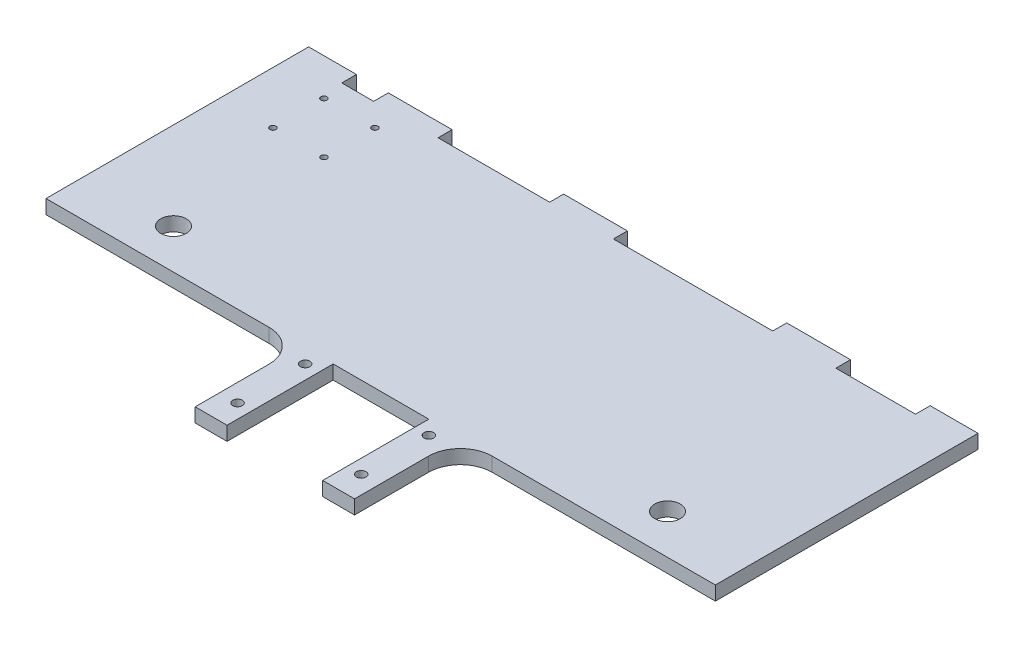
from build123d import *

# Parameters (mm, degrees)
BOSS_EXTRUDE1_DEPTH   = 5.588
F_6_CLEARANCE_HOLE1_D = 3.7973
M2_CLEARANCE_HOLE1_D  = 2.4
CUT_EXTRUDE1_REACH    = 300.407
SKETCH8_R             = 5.08


with BuildPart() as part:
    # Sketch1 → Boss-Extrude1 (new body)
    with BuildSketch(Plane(origin=(0, 0, 0), x_dir=(1, 0, 0), z_dir=(0, 1, 0))):
        with BuildLine():
            Line((12.7, 104.648), (31.75, 104.648))
            Line((31.75, 104.648), (31.75, 98.806))
            Line((31.75, 98.806), (44.45, 98.806))
            Line((44.45, 98.806), (44.45, 104.648))
            Line((44.45, 104.648), (69.85, 104.648))
            Line((69.85, 104.648), (69.85, 99.06))
            Line((69.85, 99.06), (114.3, 99.06))
            Line((114.3, 99.06), (114.3, 104.648))
            Line((114.3, 104.648), (139.7, 104.648))
            Line((139.7, 104.648), (139.7, 99.06))
            Line((139.7, 99.06), (203.2, 99.06))
            Line((203.2, 99.06), (203.2, 104.648))
            Line((203.2, 104.648), (228.6, 104.648))
            Line((228.6, 104.648), (228.6, 98.806))
            Line((228.6, 98.806), (260.35, 98.806))
            Line((260.35, 98.806), (260.35, 104.648))
            Line((260.35, 104.648), (279.4, 104.648))
            Line((279.4, 104.648), (279.4, 0))
            Line((279.4, 0), (190.5, 0))
            ThreePointArc((190.5, 0), (181.519743879, -3.719743879), (177.8, -12.7))
            Line((177.8, -12.7), (177.8, -42.164))
            Line((177.8, -42.164), (165.1, -42.164))
            Line((165.1, -42.164), (165.1, 0.122766638))
            Line((165.1, 0.122766638), (146.05, 0.122766638))
            Line((146.05, 0.122766638), (127, 0.122766638))
            Line((127, 0.122766638), (127, -42.164))
            Line((127, -42.164), (114.3, -42.164))
            Line((114.3, -42.164), (114.3, -12.7))
            ThreePointArc((114.3, -12.7), (110.580256121, -3.719743879), (101.6, 0))
            Line((101.6, 0), (12.7, 0))
            Line((12.7, 0), (12.7, 104.648))
        make_face()
    extrude(amount=BOSS_EXTRUDE1_DEPTH)

    # #6 Clearance Hole1 (through all)
    with Locations(Plane(origin=(0, 0, 0), x_dir=(-1, 0, 0), z_dir=(0, -1, 0))):
        with Locations((-121.412, -32.397617544), (-170.688, -32.397617544), (-170.688, -5.456849181), (-121.412, -5.456849181)):
            Hole(F_6_CLEARANCE_HOLE1_D / 2)

    # M2 Clearance Hole1 (through all)
    with Locations(Plane(origin=(0, 5.588, 0), x_dir=(1, 0, 0), z_dir=(0, 1, 0))):
        with Locations((33.528, 89.916), (53.848, 89.916), (53.848, 69.596), (33.528, 69.596)):
            Hole(M2_CLEARANCE_HOLE1_D / 2)

    # Sketch8 → Cut-Extrude1 (cut, up to next)
    with BuildSketch(Plane(origin=(0, 5.588, 0), x_dir=(1, 0, 0), z_dir=(0, 1, 0)), mode=Mode.PRIVATE) as cut_extrude1_sk1:
        with Locations((47.625, 15.870766638)):
            Circle(SKETCH8_R)
    cut_extrude1_tool1 = extrude(cut_extrude1_sk1.sketch, amount=-CUT_EXTRUDE1_REACH, mode=Mode.PRIVATE) & part.part
    # Sketch8 → Cut-Extrude1 (cut, up to next)
    with BuildSketch(Plane(origin=(0, 5.588, 0), x_dir=(1, 0, 0), z_dir=(0, 1, 0)), mode=Mode.PRIVATE) as cut_extrude1_sk2:
        with Locations((244.475, 15.870766638)):
            Circle(SKETCH8_R)
    cut_extrude1_tool2 = extrude(cut_extrude1_sk2.sketch, amount=-CUT_EXTRUDE1_REACH, mode=Mode.PRIVATE) & part.part
    add(cut_extrude1_tool1.solids().sort_by_distance((47.625, 5.588, -15.870767))[0], mode=Mode.SUBTRACT)
    add(cut_extrude1_tool2.solids().sort_by_distance((244.475, 5.588, -15.870767))[0], mode=Mode.SUBTRACT)


solid = part.part
